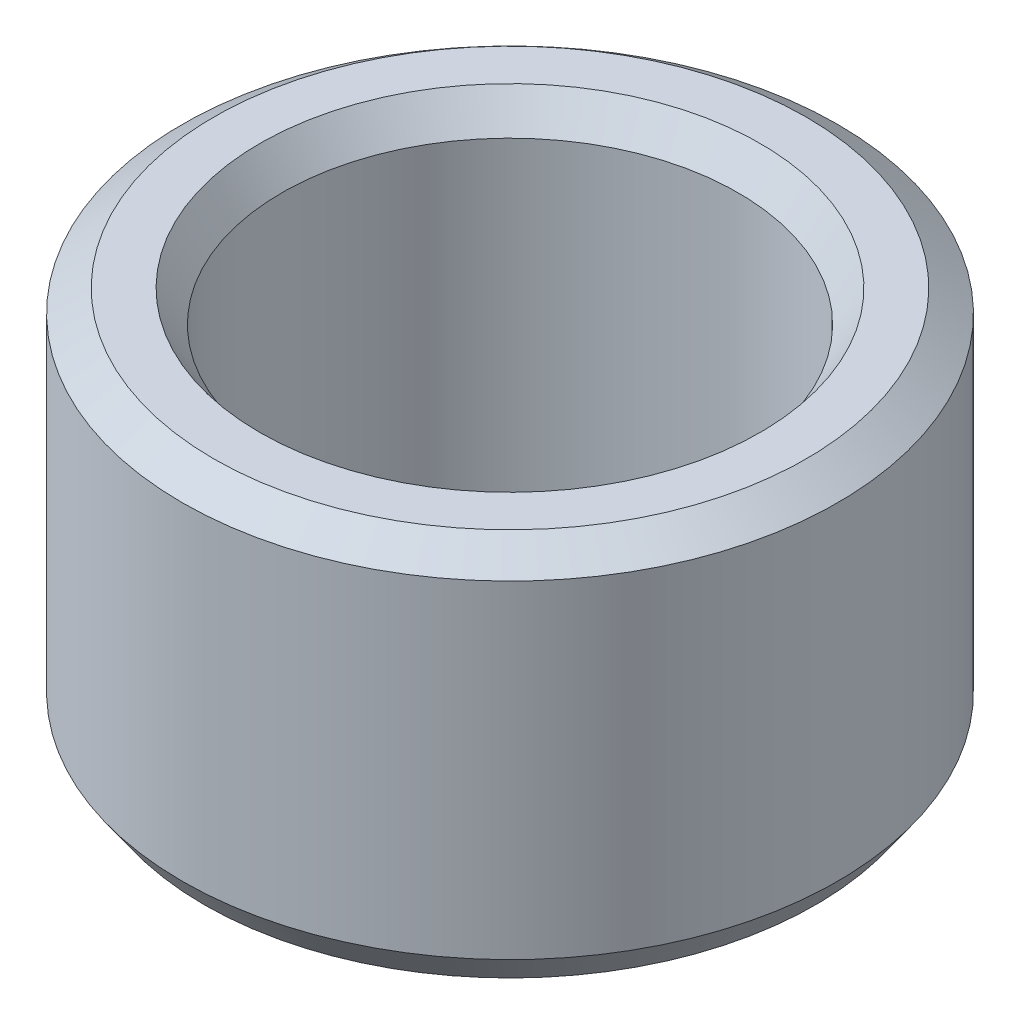
from build123d import *
from OCP.BRepFilletAPI import BRepFilletAPI_MakeChamfer

# Parameters (mm, degrees)
SKETCH1_R           = 55
BOSS_EXTRUDE1_DEPTH = 64.03269604
SKETCH2_R           = 38.287669852
CUT_EXTRUDE1_DEPTH  = 101.748132301
CHAMFER1_SIZE       = 3.7161837
CHAMFER1_SIZE2      = 5.297246278


with BuildPart() as part:
    # Sketch1 → Boss-Extrude1 (new body)
    with BuildSketch(Plane(origin=(0, 0, 0), x_dir=(1, 0, 0), z_dir=(0, 1, 0))):
        Circle(SKETCH1_R)
    extrude(amount=BOSS_EXTRUDE1_DEPTH)

    # Sketch2 → Cut-Extrude1 (cut, through all)
    with BuildSketch(Plane(origin=(0, 0, 0), x_dir=(1, 0, 0), z_dir=(0, 1, 0))):
        Circle(SKETCH2_R)
    extrude(amount=CUT_EXTRUDE1_DEPTH, mode=Mode.SUBTRACT)

    # Chamfer1: one chamfer whose edges measure the first distance from different faces: ONE call of the kernel's chamfer builder (chamfer() names one face for all edges)
    chamfer1_edges_1 = [part.edges().sort_by_distance(p)[0] for p in [
        (-38.287669852, 64.03269604, 0),
    ]]
    chamfer1_side_1 = [part.faces().sort_by_distance(p)[0] for p in [
        (-53.444365081, 64.03269604, 0),
    ]]
    chamfer1_edges_2 = [part.edges().sort_by_distance(p)[0] for p in [
        (-38.287669852, 0, 0),
    ]]
    chamfer1_side_2 = [part.faces().sort_by_distance(p)[0] for p in [
        (-38.287669852, 32.01634802, 0),
    ]]
    chamfer1_edges_3 = [part.edges().sort_by_distance(p)[0] for p in [
        (-55, 0, 0),
    ]]
    chamfer1_side_3 = [part.faces().sort_by_distance(p)[0] for p in [
        (-53.444365081, 0, 0),
    ]]
    chamfer1_edges_4 = [part.edges().sort_by_distance(p)[0] for p in [
        (-55, 64.03269604, 0),
    ]]
    chamfer1_side_4 = [part.faces().sort_by_distance(p)[0] for p in [
        (-55, 32.01634802, 0),
    ]]
    chamfer1 = BRepFilletAPI_MakeChamfer(part.part.solid().wrapped)
    for e in chamfer1_edges_1:
        chamfer1.Add(CHAMFER1_SIZE, CHAMFER1_SIZE2, e.wrapped, chamfer1_side_1[0].wrapped)  # the first distance lies on this face
    for e in chamfer1_edges_2:
        chamfer1.Add(CHAMFER1_SIZE, CHAMFER1_SIZE2, e.wrapped, chamfer1_side_2[0].wrapped)  # the first distance lies on this face
    for e in chamfer1_edges_3:
        chamfer1.Add(CHAMFER1_SIZE, CHAMFER1_SIZE2, e.wrapped, chamfer1_side_3[0].wrapped)  # the first distance lies on this face
    for e in chamfer1_edges_4:
        chamfer1.Add(CHAMFER1_SIZE, CHAMFER1_SIZE2, e.wrapped, chamfer1_side_4[0].wrapped)  # the first distance lies on this face
    add(Compound.cast(chamfer1.Shape()), mode=Mode.REPLACE)


solid = part.part
